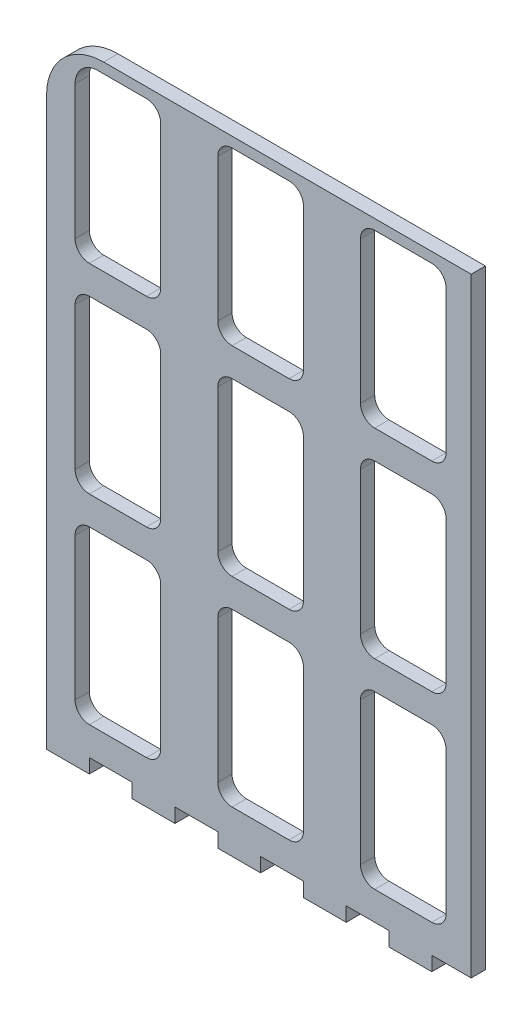
from build123d import *

# Parameters (mm, degrees)
BOSS_EXTRUDE1_DEPTH = 6.35
CUT_EXTRUDE1_DEPTH  = 331.667127275


with BuildPart() as part:
    # Sketch1 → Boss-Extrude1 (new body)
    with BuildSketch(Plane.XY):
        with BuildLine():
            Line((171.45, 0), (188.976, 0))
            Line((188.976, 0), (188.976, 271.272))
            Line((188.976, 271.272), (25.4, 271.272))
            ThreePointArc((25.4, 271.272), (7.439487758, 263.832512242), (0, 245.872))
            Line((0, 245.872), (0, 0))
            Line((0, 0), (0, -6.35))
            Line((0, -6.35), (19.05, -6.35))
            Line((19.05, -6.35), (19.05, 0))
            Line((19.05, 0), (38.1, 0))
            Line((38.1, 0), (38.1, -6.35))
            Line((38.1, -6.35), (57.15, -6.35))
            Line((57.15, -6.35), (57.15, 0))
            Line((57.15, 0), (76.2, 0))
            Line((76.2, 0), (76.2, -6.35))
            Line((76.2, -6.35), (95.25, -6.35))
            Line((95.25, -6.35), (95.25, 0))
            Line((95.25, 0), (114.3, 0))
            Line((114.3, 0), (114.3, -6.35))
            Line((114.3, -6.35), (133.35, -6.35))
            Line((133.35, -6.35), (133.35, 0))
            Line((133.35, 0), (152.4, 0))
            Line((152.4, 0), (152.4, -6.35))
            Line((152.4, -6.35), (171.45, -6.35))
            Line((171.45, -6.35), (171.45, 0))
        make_face()
    extrude(amount=BOSS_EXTRUDE1_DEPTH)

    # Sketch2 → Cut-Extrude1 (cut, through all)
    with BuildSketch(Plane.XY.offset(6.35)):
        with BuildLine():
            Line((44.45, 266.7), (22.86, 266.7))
            ThreePointArc((22.86, 266.7), (15.675795103, 263.724204897), (12.7, 256.54))
            Line((12.7, 256.54), (12.7, 196.85))
            ThreePointArc((12.7, 196.85), (14.559871939, 192.359871939), (19.05, 190.5))
            Line((19.05, 190.5), (44.45, 190.5))
            ThreePointArc((44.45, 190.5), (48.940128061, 192.359871939), (50.8, 196.85))
            Line((50.8, 196.85), (50.8, 260.35))
            ThreePointArc((50.8, 260.35), (48.940128061, 264.840128061), (44.45, 266.7))
        make_face()
        with BuildLine():
            Line((76.2, 19.05), (76.2, 82.55))
            ThreePointArc((76.2, 82.55), (78.059871939, 87.040128061), (82.55, 88.9))
            Line((82.55, 88.9), (107.95, 88.9))
            ThreePointArc((107.95, 88.9), (112.440128061, 87.040128061), (114.3, 82.55))
            Line((114.3, 82.55), (114.3, 19.05))
            ThreePointArc((114.3, 19.05), (112.440128061, 14.559871939), (107.95, 12.7))
            Line((107.95, 12.7), (82.55, 12.7))
            ThreePointArc((82.55, 12.7), (78.059871939, 14.559871939), (76.2, 19.05))
        make_face()
        with BuildLine():
            Line((19.05, 12.7), (44.45, 12.7))
            ThreePointArc((44.45, 12.7), (48.940128061, 14.559871939), (50.8, 19.05))
            Line((50.8, 19.05), (50.8, 82.55))
            ThreePointArc((50.8, 82.55), (48.940128061, 87.040128061), (44.45, 88.9))
            Line((44.45, 88.9), (19.05, 88.9))
            ThreePointArc((19.05, 88.9), (14.559871939, 87.040128061), (12.7, 82.55))
            Line((12.7, 82.55), (12.7, 19.05))
            ThreePointArc((12.7, 19.05), (14.559871939, 14.559871939), (19.05, 12.7))
        make_face()
        with BuildLine():
            Line((139.7, 19.05), (139.7, 82.55))
            ThreePointArc((139.7, 82.55), (141.559871939, 87.040128061), (146.05, 88.9))
            Line((146.05, 88.9), (171.45, 88.9))
            ThreePointArc((171.45, 88.9), (175.940128061, 87.040128061), (177.8, 82.55))
            Line((177.8, 82.55), (177.8, 19.05))
            ThreePointArc((177.8, 19.05), (175.940128061, 14.559871939), (171.45, 12.7))
            Line((171.45, 12.7), (146.05, 12.7))
            ThreePointArc((146.05, 12.7), (141.559871939, 14.559871939), (139.7, 19.05))
        make_face()
        with BuildLine():
            Line((76.2, 107.95), (76.2, 171.45))
            ThreePointArc((76.2, 171.45), (78.059871939, 175.940128061), (82.55, 177.8))
            Line((82.55, 177.8), (107.95, 177.8))
            ThreePointArc((107.95, 177.8), (112.440128061, 175.940128061), (114.3, 171.45))
            Line((114.3, 171.45), (114.3, 107.95))
            ThreePointArc((114.3, 107.95), (112.440128061, 103.459871939), (107.95, 101.6))
            Line((107.95, 101.6), (82.55, 101.6))
            ThreePointArc((82.55, 101.6), (78.059871939, 103.459871939), (76.2, 107.95))
        make_face()
        with BuildLine():
            Line((139.7, 107.95), (139.7, 171.45))
            ThreePointArc((139.7, 171.45), (141.559871939, 175.940128061), (146.05, 177.8))
            Line((146.05, 177.8), (171.45, 177.8))
            ThreePointArc((171.45, 177.8), (175.940128061, 175.940128061), (177.8, 171.45))
            Line((177.8, 171.45), (177.8, 107.95))
            ThreePointArc((177.8, 107.95), (175.940128061, 103.459871939), (171.45, 101.6))
            Line((171.45, 101.6), (146.05, 101.6))
            ThreePointArc((146.05, 101.6), (141.559871939, 103.459871939), (139.7, 107.95))
        make_face()
        with BuildLine():
            Line((76.2, 196.85), (76.2, 260.35))
            ThreePointArc((76.2, 260.35), (78.059871939, 264.840128061), (82.55, 266.7))
            Line((82.55, 266.7), (107.95, 266.7))
            ThreePointArc((107.95, 266.7), (112.440128061, 264.840128061), (114.3, 260.35))
            Line((114.3, 260.35), (114.3, 196.85))
            ThreePointArc((114.3, 196.85), (112.440128061, 192.359871939), (107.95, 190.5))
            Line((107.95, 190.5), (82.55, 190.5))
            ThreePointArc((82.55, 190.5), (78.059871939, 192.359871939), (76.2, 196.85))
        make_face()
        with BuildLine():
            Line((139.7, 196.85), (139.7, 260.35))
            ThreePointArc((139.7, 260.35), (141.559871939, 264.840128061), (146.05, 266.7))
            Line((146.05, 266.7), (171.45, 266.7))
            ThreePointArc((171.45, 266.7), (175.940128061, 264.840128061), (177.8, 260.35))
            Line((177.8, 260.35), (177.8, 196.85))
            ThreePointArc((177.8, 196.85), (175.940128061, 192.359871939), (171.45, 190.5))
            Line((171.45, 190.5), (146.05, 190.5))
            ThreePointArc((146.05, 190.5), (141.559871939, 192.359871939), (139.7, 196.85))
        make_face()
        with BuildLine():
            Line((12.7, 107.95), (12.7, 171.45))
            ThreePointArc((12.7, 171.45), (14.559871939, 175.940128061), (19.05, 177.8))
            Line((19.05, 177.8), (44.45, 177.8))
            ThreePointArc((44.45, 177.8), (48.940128061, 175.940128061), (50.8, 171.45))
            Line((50.8, 171.45), (50.8, 107.95))
            ThreePointArc((50.8, 107.95), (48.940128061, 103.459871939), (44.45, 101.6))
            Line((44.45, 101.6), (19.05, 101.6))
            ThreePointArc((19.05, 101.6), (14.559871939, 103.459871939), (12.7, 107.95))
        make_face()
    extrude(amount=-CUT_EXTRUDE1_DEPTH, mode=Mode.SUBTRACT)


solid = part.part
